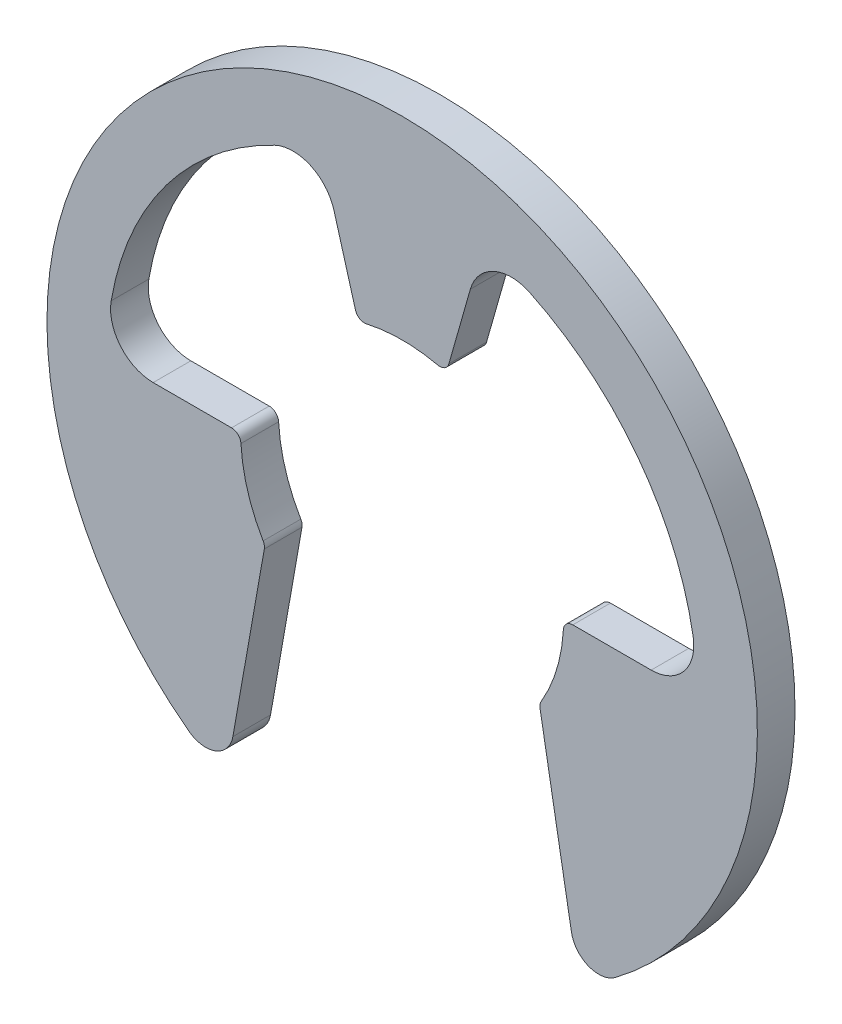
from build123d import *

# Parameters (mm, degrees)
SKETCH3_W               = 8.382
SKETCH3_H               = 0.889
CUT_EXTRUDE1_DEPTH      = 12.862269102
CUT_EXTRUDE1_DEPTH_BACK = 12.862269102
FILLET1_R               = 1.00584
FILLET2_R               = 0.653796
FILLET3_R               = 0.22225


with BuildPart() as part:
    # Sketch3 → Revolve1 (revolve)
    with BuildSketch(Plane(origin=(0, 0, 0), x_dir=(1, 0, 0), z_dir=(0, 1, 0))):
        with Locations((-4.191, 0)):
            Rectangle(SKETCH3_W, SKETCH3_H)
    revolve(axis=Axis((0, 0, -0.4445), (0, 0, 1)))

    # Sketch4 → Cut-Extrude1 (cut, two sides: drawn at the far end of the back side and taken through both)
    with BuildSketch(Plane.XY.offset(-CUT_EXTRUDE1_DEPTH_BACK)):
        with BuildLine():
            Line((1.043411472, 3.664340664), (1.907952406, 6.700508642))
            ThreePointArc((1.907952406, 6.700508642), (5.560104779, 4.197896295), (6.966857143, 0))
            Line((6.966857143, 0), (3.81, 0))
            ThreePointArc((3.81, 0), (3.664340664, -1.043411472), (3.2385, -2.00704204))
            Line((3.2385, -2.00704204), (4.167000213, -7.27282842))
            ThreePointArc((4.167000213, -7.27282842), (0, -8.382), (-4.167000213, -7.27282842))
            Line((-4.167000213, -7.27282842), (-3.2385, -2.00704204))
            ThreePointArc((-3.2385, -2.00704204), (-3.664340664, -1.043411472), (-3.81, 0))
            Line((-3.81, 0), (-6.966857143, 0))
            ThreePointArc((-6.966857143, 0), (-5.560104779, 4.197896295), (-1.907952406, 6.700508642))
            Line((-1.907952406, 6.700508642), (-1.043411472, 3.664340664))
            ThreePointArc((-1.043411472, 3.664340664), (0, 3.81), (1.043411472, 3.664340664))
        make_face()
    extrude(amount=CUT_EXTRUDE1_DEPTH + CUT_EXTRUDE1_DEPTH_BACK, mode=Mode.SUBTRACT)

    # Fillet1
    fillet1_edges = [part.edges().sort_by_distance(p)[0] for p in [
        (6.966857143, 0, 0),
        (1.907952406, 6.700508642, 0),
        (-1.907952406, 6.700508642, 0),
        (-6.966857143, 0, 0),
    ]]
    fillet(fillet1_edges, radius=FILLET1_R)

    # Fillet2
    fillet2_edges = [part.edges().sort_by_distance(p)[0] for p in [
        (4.167000213, -7.27282842, 0),
        (-4.167000213, -7.27282842, 0),
    ]]
    fillet(fillet2_edges, radius=FILLET2_R)

    # Fillet3
    fillet3_edges = [part.edges().sort_by_distance(p)[0] for p in [
        (3.2385, -2.00704204, 0),
        (3.81, 0, 0),
        (1.043411472, 3.664340664, 0),
        (-1.043411472, 3.664340664, 0),
        (-3.2385, -2.00704204, 0),
        (-3.81, 0, 0),
    ]]
    fillet(fillet3_edges, radius=FILLET3_R)


solid = part.part
